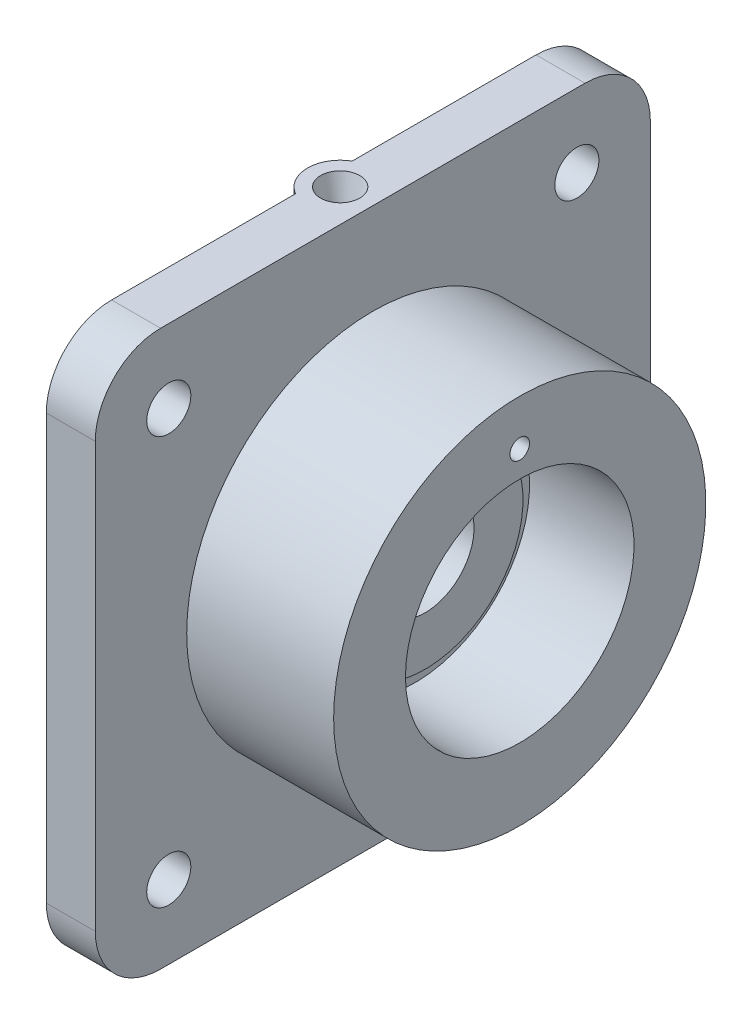
from build123d import *

# Parameters (mm, degrees)
SKETCH_2_R          = 6.75
SKETCH_2_R_2        = 20
EXTRUDE_1_DEPTH     = 15
EXTRUDE_2_REACH     = 208.216
SKETCH_3_R          = 10
SKETCH_6_R          = 3
CUT_EXTRUDE_1_DEPTH = 33
SKETCH_8_R          = 3
CUT_EXTRUDE_2_DEPTH = 58
EXTRUDE_START       = 6
EXTRUDE_3_DEPTH     = 6
EXTRUDE_4_DEPTH     = 58


with BuildPart() as part:
    # Эскиз1 → Повернуть1 (revolve)
    with BuildSketch(Plane.XY, mode=Mode.PRIVATE) as revolve_1_sk:
        Polygon((0, -15), (0, -25), (20, -28.526539614), (20, -57), (80, -57), (80, -35), (48, -35), (48, -30), (51, -30), (51, -15), (39, -15), (39, -20), (34, -20), (34, -15), (29, -15), (29, -20), (24, -20), (24, -15), align=None)
    revolve(revolve_1_sk.sketch.rotate(Axis((-987.033440026, 0, 0), (1, 0, 0)), 270), axis=Axis((-987.033440026, 0, 0), (1, 0, 0)))

    # Эскиз2 → Бобышка-Вытянуть1 (add)
    with BuildSketch(Plane.ZY.offset(-20)):
        with BuildLine():
            Line((-65, -85), (65, -85))
            ThreePointArc((65, -85), (79.142135624, -79.142135624), (85, -65))
            Line((85, -65), (85, 65))
            ThreePointArc((85, 65), (79.142135624, 79.142135624), (65, 85))
            Line((65, 85), (-65, 85))
            ThreePointArc((-65, 85), (-79.142135624, 79.142135624), (-85, 65))
            Line((-85, 65), (-85, -65))
            ThreePointArc((-85, -65), (-79.142135624, -79.142135624), (-65, -85))
        make_face()
        with Locations((-62.5, -62.5)):
            Circle(SKETCH_2_R, mode=Mode.SUBTRACT)
        with Locations((-62.5, 62.5)):
            Circle(SKETCH_2_R, mode=Mode.SUBTRACT)
        with Locations((62.5, 62.5)):
            Circle(SKETCH_2_R, mode=Mode.SUBTRACT)
        with Locations((62.5, -62.5)):
            Circle(SKETCH_2_R, mode=Mode.SUBTRACT)
        Circle(SKETCH_2_R_2, mode=Mode.SUBTRACT)
    extrude(amount=-EXTRUDE_1_DEPTH)

    # Эскиз3 → Бобышка-Вытянуть2 (add, up to next)
    with BuildSketch(Plane(origin=(0, 85, 0), x_dir=(1, 0, 0), z_dir=(0, 1, 0)), mode=Mode.PRIVATE) as extrude_2_sk1:
        with Locations((25, 0)):
            Circle(SKETCH_3_R)
    extrude_2_tool1 = extrude(extrude_2_sk1.sketch, amount=-EXTRUDE_2_REACH, mode=Mode.PRIVATE) - part.part
    add(extrude_2_tool1.solids().sort_by_distance((25, 85, 0))[0])

    # Вырез-По сечениям1: read off the stored shape, not the designer's step
    # Вырез-По сечениям1: loft between two sections, ruled curve by curve
    loft_1_from = [
        Edge.make_bspline([(25.773422165, 73, -2.898588994), (19.976244177, 73, -4.445433323), (18.429399848, 73, 1.351744665), (24.226577835, 73, 2.898588994), (30.023755823, 73, 4.445433323), (31.570600152, 73, -1.351744665), (25.773422165, 73, -2.898588994)], [0, 0, 0, 0, 0.5, 0.5, 0.5, 1, 1, 1, 1], 3, [1, 0.333333333, 0.333333333, 1, 0.333333333, 0.333333333, 1]),
    ]
    loft_1_to = [
        Edge.make_bspline([(23.045798977, 85, -5.672838651), (11.700121675, 85, -1.764436604), (15.608523722, 85, 9.581240698), (26.954201023, 85, 5.672838651), (38.299878325, 85, 1.764436604), (34.391476278, 85, -9.581240698), (23.045798977, 85, -5.672838651)], [0, 0, 0, 0, 0.5, 0.5, 0.5, 1, 1, 1, 1], 3, [1, 0.333333333, 0.333333333, 1, 0.333333333, 0.333333333, 1]),
    ]
    loft_1 = Solid(Shell([*[Face.make_surface_from_curves(loft_1_from[k], loft_1_to[k]) for k in range(1)], Face(Wire(loft_1_from)), Face(Wire(loft_1_to))]))
    add(loft_1, mode=Mode.SUBTRACT)

    # Эскиз6 → Вырез-Вытянуть1 (cut)
    with BuildSketch(Plane(origin=(0, 73, 0), x_dir=(1, 0, 0), z_dir=(0, 1, 0))):
        with Locations(Location((25, 0, 0), (0, 0, 270))):
            Circle(SKETCH_6_R)
    extrude(amount=-CUT_EXTRUDE_1_DEPTH, mode=Mode.SUBTRACT)

    # Эскиз8 → Вырез-Вытянуть2 (cut)
    with BuildSketch(Plane(origin=(80, 0, 0), x_dir=(0, 0, -1), z_dir=(1, 0, 0))):
        with Locations((0, 43)):
            Circle(SKETCH_8_R)
    extrude(amount=-CUT_EXTRUDE_2_DEPTH, mode=Mode.SUBTRACT)

    # Эскиз10 → Бобышка-Вытянуть3 (add)
    with BuildSketch(Plane(origin=(0, 40, 0), x_dir=(1, 0, 0), z_dir=(0, 1, 0)).offset(EXTRUDE_START)):
        with BuildLine():
            Line((25, 3), (25, 4.5))
            ThreePointArc((25, 4.5), (20.5, 0), (25, -4.5))
            Line((25, -4.5), (25, -3))
            ThreePointArc((25, -3), (22, 0), (25, 3))
        make_face()
    extrude(amount=-EXTRUDE_3_DEPTH)

    # Эскиз11 → Бобышка-Вытянуть4 (add)
    with BuildSketch(Plane(origin=(80, 0, 0), x_dir=(0, 0, -1), z_dir=(1, 0, 0))):
        with BuildLine():
            Line((3, 43), (4.5, 43))
            ThreePointArc((4.5, 43), (0, 38.5), (-4.5, 43))
            Line((-4.5, 43), (-3, 43))
            ThreePointArc((-3, 43), (0, 40), (3, 43))
        make_face()
    extrude(amount=-EXTRUDE_4_DEPTH)


solid = part.part
